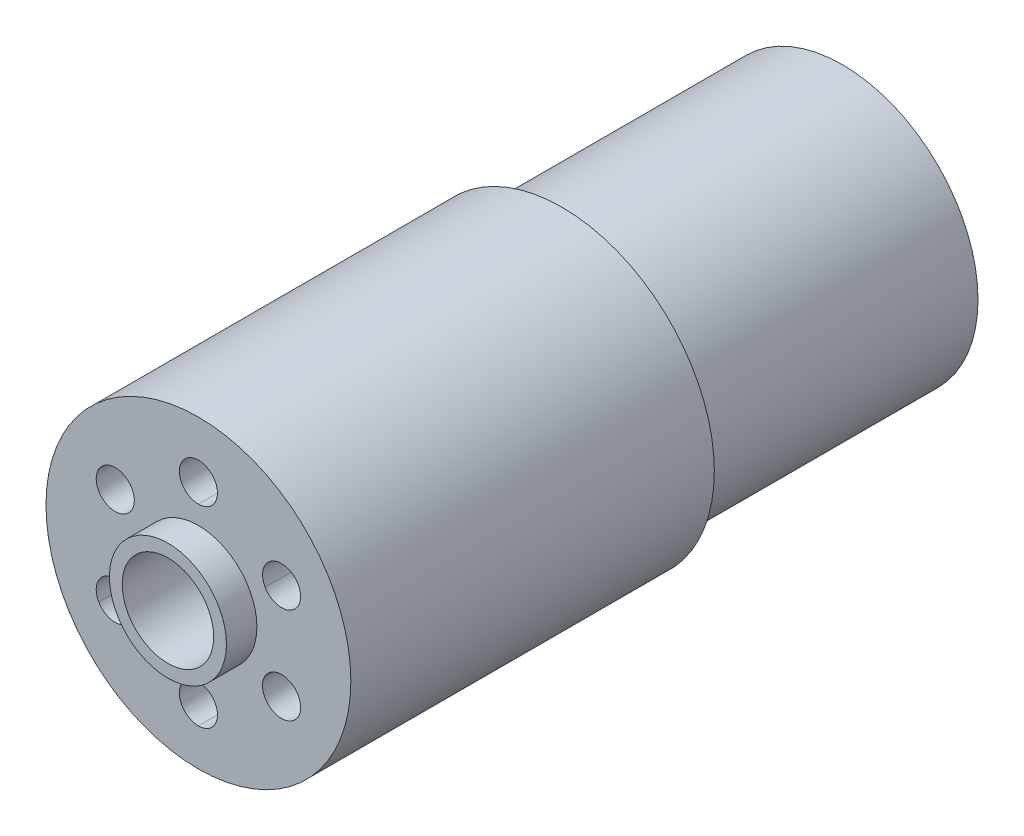
from build123d import *
from build123d.topology import SkipClean

# Parameters (mm, degrees)
SKETCH1_R           = 25.4
BOSS_EXTRUDE2_DEPTH = 107.315
SKETCH6_R           = 7.62
SKETCH6_R_2         = 3.175
CUT_EXTRUDE1_DEPTH  = 108.458
SKETCH7_R           = 25.4
SKETCH7_R_2         = 22.606
CUT_EXTRUDE2_DEPTH  = 46.736
SKETCH8_R           = 9.75
SKETCH8_R_2         = 7.62
BOSS_EXTRUDE7_DEPTH = 5.08
BOSS_EXTRUDE8_START = 5.08
SKETCH9_R           = 9.75
SKETCH9_R_2         = 7.62
BOSS_EXTRUDE8_DEPTH = 5.08


with BuildPart() as part:
    # Sketch1 → Boss-Extrude2 (new body)
    with BuildSketch(Plane.XY):
        Circle(SKETCH1_R)
    extrude(amount=BOSS_EXTRUDE2_DEPTH)

    # Sketch6 → Cut-Extrude1 (cut)
    with BuildSketch(Plane(origin=(0, 0, 0), x_dir=(-1, 0, 0), z_dir=(0, 0, -1))):
        Circle(SKETCH6_R)
        with Locations((-13.858138511, 8.001)):
            Circle(SKETCH6_R_2)
        with Locations((0, 16.002)):
            Circle(SKETCH6_R_2)
        with Locations((13.858138511, 8.001)):
            Circle(SKETCH6_R_2)
        with Locations((13.858138511, -8.001)):
            Circle(SKETCH6_R_2)
        with Locations((0, -16.002)):
            Circle(SKETCH6_R_2)
        with Locations((-13.858138511, -8.001)):
            Circle(SKETCH6_R_2)
    extrude(amount=-CUT_EXTRUDE1_DEPTH, mode=Mode.SUBTRACT)

    # Sketch7 → Cut-Extrude2 (cut)
    with BuildSketch(Plane(origin=(0, 0, 0), x_dir=(-1, 0, 0), z_dir=(0, 0, -1))):
        Circle(SKETCH7_R)
        Circle(SKETCH7_R_2, mode=Mode.SUBTRACT)
    extrude(amount=-CUT_EXTRUDE2_DEPTH, mode=Mode.SUBTRACT)

    # Sketch8 → Boss-Extrude7 (add)
    with SkipClean():  # the faces are left unmerged after this step: merging them gives an invalid solid
        with BuildSketch(Plane.XY.offset(107.315)):
            Circle(SKETCH8_R)
            Circle(SKETCH8_R_2, mode=Mode.SUBTRACT)
        extrude(amount=BOSS_EXTRUDE7_DEPTH)

    # Sketch9 → Boss-Extrude8 (add)
    with SkipClean():  # the faces are left unmerged after this step: merging them gives an invalid solid
        with BuildSketch(Plane(origin=(0, 0, 0), x_dir=(-1, 0, 0), z_dir=(0, 0, -1)).offset(BOSS_EXTRUDE8_START)):
            Circle(SKETCH9_R)
            Circle(SKETCH9_R_2, mode=Mode.SUBTRACT)
        extrude(amount=-BOSS_EXTRUDE8_DEPTH)


solid = part.part
